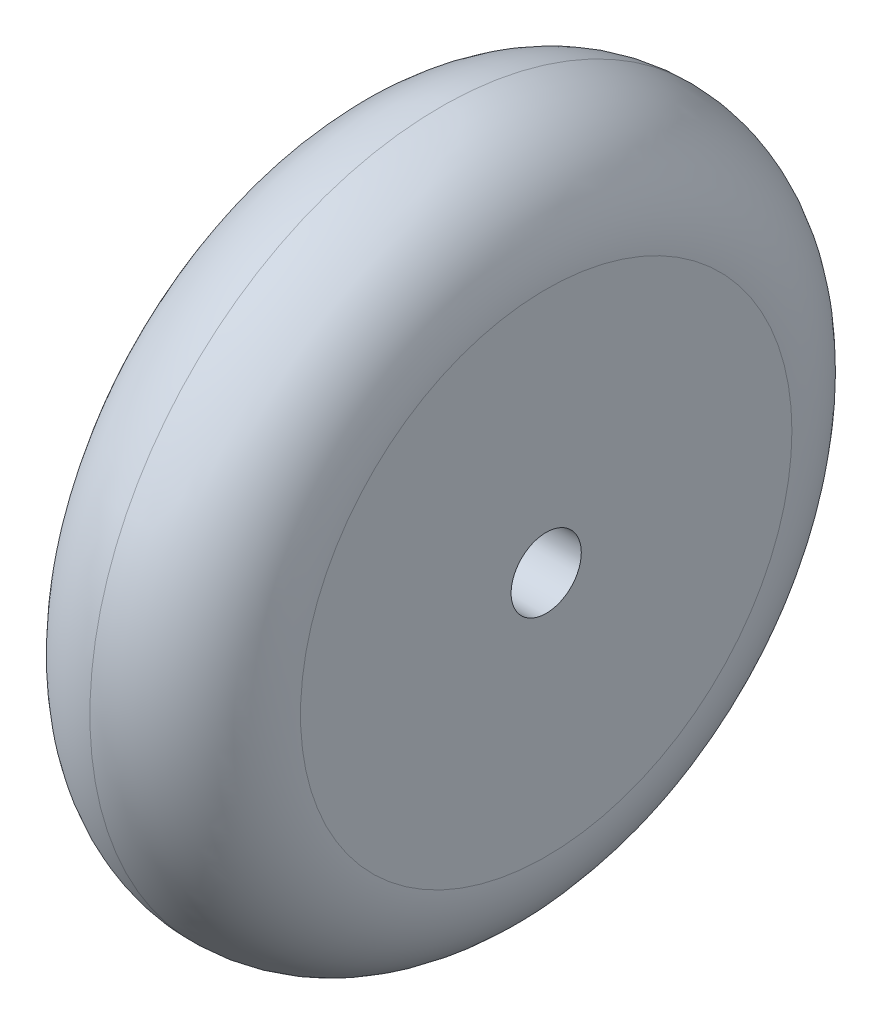
from build123d import *

# Parameters (mm, degrees)
SKETCH1_R           = 40
SKETCH1_R_2         = 4
BOSS_EXTRUDE1_DEPTH = 24
FILLET1_R           = 12


with BuildPart() as part:
    # Sketch1 → Boss-Extrude1 (new body)
    with BuildSketch(Plane(origin=(0, 0, 0), x_dir=(0, 0, -1), z_dir=(1, 0, 0))):
        Circle(SKETCH1_R)
        Circle(SKETCH1_R_2, mode=Mode.SUBTRACT)
    extrude(amount=BOSS_EXTRUDE1_DEPTH)

    # Fillet1
    fillet1_edges = [part.edges().sort_by_distance(p)[0] for p in [
        (0, 0, 40),
        (24, 0, 40),
    ]]
    fillet(fillet1_edges, radius=FILLET1_R - 0.0001)  # a hair under: the kernel refuses the full size


solid = part.part
